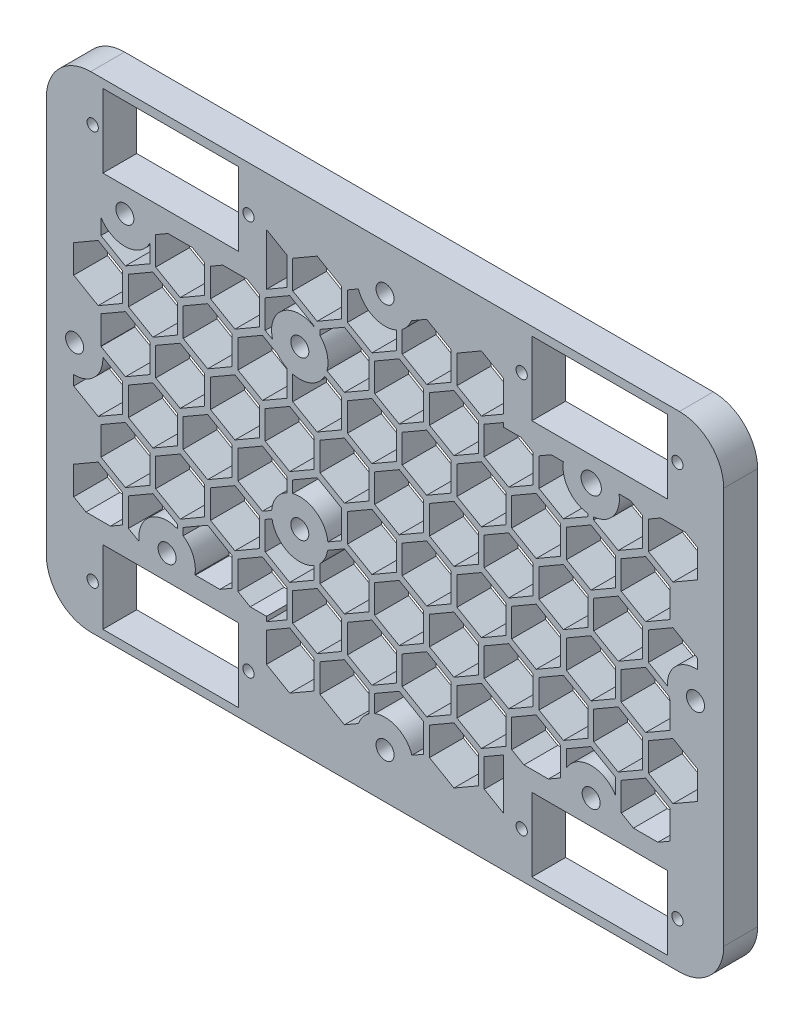
from build123d import *

# Parameters (mm, degrees)
ESQUISSE1_R        = 1.6
PLAQUE_DEPTH       = 6
ESQUISSE3_R        = 1
ESQUISSE3_W        = 24
ESQUISSE3_H        = 13
MIP_SERVO_DEPTH    = 75.060785845
CUT_EXTRUDE1_DEPTH = 10
SKETCH2_R          = 1.8
SKETCH2_R_2        = 1.6
CUT_EXTRUDE2_DEPTH = 10


with BuildPart() as part:
    # Esquisse1 → plaque (new body)
    with BuildSketch(Plane.XY):
        with BuildLine():
            Line((-60, 35.14495853), (-60, -35.14495853))
            ThreePointArc((-60, -35.14495853), (-57.69931162, -40.69931162), (-52.14495853, -43))
            Line((-52.14495853, -43), (52.14495853, -43))
            ThreePointArc((52.14495853, -43), (57.69931162, -40.69931162), (60, -35.14495853))
            Line((60, -35.14495853), (60, 35.14495853))
            ThreePointArc((60, 35.14495853), (57.69931162, 40.69931162), (52.14495853, 43))
            Line((52.14495853, 43), (-52.14495853, 43))
            ThreePointArc((-52.14495853, 43), (-57.69931162, 40.69931162), (-60, 35.14495853))
        make_face()
        with Locations((0, -35)):
            Circle(ESQUISSE1_R, mode=Mode.SUBTRACT)
        with Locations((-55, 0)):
            Circle(ESQUISSE1_R, mode=Mode.SUBTRACT)
        with Locations((55, 0)):
            Circle(ESQUISSE1_R, mode=Mode.SUBTRACT)
        with Locations((0, 35)):
            Circle(ESQUISSE1_R, mode=Mode.SUBTRACT)
    extrude(amount=PLAQUE_DEPTH)

    # Esquisse3 → MIP_SERVO (cut, through all)
    with BuildSketch(Plane.XY):
        with Locations((-51.8, 35)):
            Circle(ESQUISSE3_R)
        with Locations((-24.2, 35)):
            Circle(ESQUISSE3_R)
        with Locations((51.8, 35)):
            Circle(ESQUISSE3_R)
        with Locations((24.2, 35)):
            Circle(ESQUISSE3_R)
        with Locations((24.2, -35)):
            Circle(ESQUISSE3_R)
        with Locations((51.8, -35)):
            Circle(ESQUISSE3_R)
        with Locations((-24.2, -35)):
            Circle(ESQUISSE3_R)
        with Locations((-51.8, -35)):
            Circle(ESQUISSE3_R)
        with Locations((38, 35)):
            Rectangle(ESQUISSE3_W, ESQUISSE3_H)
        with Locations((-38, 35)):
            Rectangle(ESQUISSE3_W, ESQUISSE3_H)
        with Locations((38, -35)):
            Rectangle(ESQUISSE3_W, ESQUISSE3_H)
        with Locations((-38, -35)):
            Rectangle(ESQUISSE3_W, ESQUISSE3_H)
    extrude(amount=MIP_SERVO_DEPTH, mode=Mode.SUBTRACT)

    # Sketch1 → Cut-Extrude1 (cut)
    with BuildSketch(Plane(origin=(0, 0, 0), x_dir=(-1, 0, 0), z_dir=(0, 0, -1))):
        Polygon((-53.165063509, 25), (-55.330127019, 23.75), (-55.330127019, 18.75), (-51, 16.25), (-46.669872981, 18.75), (-46.669872981, 23.75), (-48.834936491, 25), align=None)
        Polygon((-21, 32.480940108), (-21, 27.019059892), (-17.069872981, 24.75), (-12.739745962, 27.25), (-12.739745962, 32.25), (-17.069872981, 34.75), align=None)
        with BuildLine():
            Line((-41.451478548, 25), (-43.465063509, 25))
            Line((-43.465063509, 25), (-45.630127019, 23.75))
            Line((-45.630127019, 23.75), (-45.630127019, 18.75))
            Line((-45.630127019, 18.75), (-41.3, 16.25))
            Line((-41.3, 16.25), (-36.969872981, 18.75))
            Line((-36.969872981, 18.75), (-36.969872981, 19.22418213))
            ThreePointArc((-36.969872981, 19.22418213), (-40.465634941, 21.138335979), (-41.451478548, 25))
        make_face()
        Polygon((-17.569872981, 23.75), (-21, 25.730384758), (-21, 25), (-24.065063509, 25), (-26.230127019, 23.75), (-26.230127019, 18.75), (-21.9, 16.25), (-17.569872981, 18.75), align=None)
        with BuildLine():
            ThreePointArc((-31.579183299, 25), (-32.525099806, 21.190497232), (-35.930127019, 19.23784287))
            Line((-35.930127019, 19.23784287), (-35.930127019, 18.75))
            Line((-35.930127019, 18.75), (-31.6, 16.25))
            Line((-31.6, 16.25), (-27.269872981, 18.75))
            Line((-27.269872981, 18.75), (-27.269872981, 23.75))
            Line((-27.269872981, 23.75), (-29.434936491, 25))
            Line((-29.434936491, 25), (-31.579183299, 25))
        make_face()
        Polygon((-12.2, 26.25), (-16.530127019, 23.75), (-16.530127019, 18.75), (-12.2, 16.25), (-7.869872981, 18.75), (-7.869872981, 23.75), align=None)
        with BuildLine():
            Line((-11.7, 32.25), (-11.7, 27.25))
            Line((-11.7, 27.25), (-7.369872981, 24.75))
            Line((-7.369872981, 24.75), (-3.039745962, 27.25))
            Line((-3.039745962, 27.25), (-3.039745962, 31.030120344))
            ThreePointArc((-3.039745962, 31.030120344), (-3.997227272, 31.996306584), (-4.658867985, 33.184800536))
            Line((-4.658867985, 33.184800536), (-7.369872981, 34.75))
            Line((-7.369872981, 34.75), (-11.7, 32.25))
        make_face()
        with BuildLine():
            ThreePointArc((4.725770022, 33.366874867), (2.008051346, 30.420946627), (-2, 30.417424305))
            Line((-2, 30.417424305), (-2, 27.25))
            Line((-2, 27.25), (2.330127019, 24.75))
            Line((2.330127019, 24.75), (6.660254038, 27.25))
            Line((6.660254038, 27.25), (6.660254038, 32.25))
            Line((6.660254038, 32.25), (4.725770022, 33.366874867))
        make_face()
        Polygon((7.7, 32.25), (7.7, 27.25), (12.030127019, 24.75), (16.360254038, 27.25), (16.360254038, 32.25), (12.030127019, 34.75), align=None)
        Polygon((17.4, 32.25), (17.4, 27.25), (21, 25.171539031), (21, 34.328460969), align=None)
        Polygon((28.765063509, 25), (24.434936491, 25), (22.269872981, 23.75), (22.269872981, 18.75), (26.6, 16.25), (30.930127019, 18.75), (30.930127019, 23.75), align=None)
        with BuildLine():
            Line((50.330127019, 18.75), (50.330127019, 21.52059519))
            ThreePointArc((50.330127019, 21.52059519), (45.888468607, 19.208427064), (41.669872981, 21.906185733))
            Line((41.669872981, 21.906185733), (41.669872981, 18.75))
            Line((41.669872981, 18.75), (46, 16.25))
            Line((46, 16.25), (50.330127019, 18.75))
        make_face()
        Polygon((38.465063509, 25), (34.134936491, 25), (31.969872981, 23.75), (31.969872981, 18.75), (36.3, 16.25), (40.630127019, 18.75), (40.630127019, 23.75), align=None)
        Polygon((-2.5, 26.25), (-6.830127019, 23.75), (-6.830127019, 18.75), (-2.5, 16.25), (1.830127019, 18.75), (1.830127019, 23.75), align=None)
        with BuildLine():
            Line((7.2, 26.25), (2.869872981, 23.75))
            Line((2.869872981, 23.75), (2.869872981, 18.75))
            Line((2.869872981, 18.75), (7.2, 16.25))
            Line((7.2, 16.25), (10.281083306, 18.028864276))
            ThreePointArc((10.281083306, 18.028864276), (10.272174258, 20.587446003), (11.530127019, 22.815443912))
            Line((11.530127019, 22.815443912), (11.530127019, 23.75))
            Line((11.530127019, 23.75), (7.2, 26.25))
        make_face()
        with BuildLine():
            ThreePointArc((16.360254038, 14.483778406), (13.094869832, 14.749117542), (10.694705093, 16.978993791))
            Line((10.694705093, 16.978993791), (7.7, 15.25))
            Line((7.7, 15.25), (7.7, 10.25))
            Line((7.7, 10.25), (12.030127019, 7.75))
            Line((12.030127019, 7.75), (16.360254038, 10.25))
            Line((16.360254038, 10.25), (16.360254038, 14.483778406))
        make_face()
        with BuildLine():
            Line((12.569872981, 23.75), (12.569872981, 23.631596355))
            ThreePointArc((12.569872981, 23.631596355), (18.148070065, 23.296277329), (19.931476585, 18.000223823))
            Line((19.931476585, 18.000223823), (21.230127019, 18.75))
            Line((21.230127019, 18.75), (21.230127019, 23.75))
            Line((21.230127019, 23.75), (16.9, 26.25))
            Line((16.9, 26.25), (12.569872981, 23.75))
        make_face()
        with BuildLine():
            ThreePointArc((18.985197283, 16.165214078), (18.258855695, 15.440944898), (17.4, 14.880137584))
            Line((17.4, 14.880137584), (17.4, 10.25))
            Line((17.4, 10.25), (21.730127019, 7.75))
            Line((21.730127019, 7.75), (26.060254038, 10.25))
            Line((26.060254038, 10.25), (26.060254038, 15.25))
            Line((26.060254038, 15.25), (21.730127019, 17.75))
            Line((21.730127019, 17.75), (18.985197283, 16.165214078))
        make_face()
        Polygon((-41.3, 9.25), (-45.630127019, 6.75), (-45.630127019, 1.75), (-41.3, -0.75), (-36.969872981, 1.75), (-36.969872981, 6.75), align=None)
        Polygon((-36.469872981, 17.75), (-40.8, 15.25), (-40.8, 10.25), (-36.469872981, 7.75), (-32.139745962, 10.25), (-32.139745962, 15.25), align=None)
        Polygon((-31.6, 9.25), (-35.930127019, 6.75), (-35.930127019, 1.75), (-31.6, -0.75), (-27.269872981, 1.75), (-27.269872981, 6.75), align=None)
        Polygon((-26.769872981, 17.75), (-31.1, 15.25), (-31.1, 10.25), (-26.769872981, 7.75), (-22.439745962, 10.25), (-22.439745962, 15.25), align=None)
        Polygon((-21.9, 9.25), (-26.230127019, 6.75), (-26.230127019, 1.75), (-21.9, -0.75), (-17.569872981, 1.75), (-17.569872981, 6.75), align=None)
        Polygon((-17.069872981, 17.75), (-21.4, 15.25), (-21.4, 10.25), (-17.069872981, 7.75), (-12.739745962, 10.25), (-12.739745962, 15.25), align=None)
        Polygon((-12.2, 9.25), (-16.530127019, 6.75), (-16.530127019, 1.75), (-12.2, -0.75), (-7.869872981, 1.75), (-7.869872981, 6.75), align=None)
        Polygon((-7.369872981, 17.75), (-11.7, 15.25), (-11.7, 10.25), (-7.369872981, 7.75), (-3.039745962, 10.25), (-3.039745962, 15.25), align=None)
        Polygon((-2.5, 9.25), (-6.830127019, 6.75), (-6.830127019, 1.75), (-2.5, -0.75), (1.830127019, 1.75), (1.830127019, 6.75), align=None)
        Polygon((2.330127019, 17.75), (-2, 15.25), (-2, 10.25), (2.330127019, 7.75), (6.660254038, 10.25), (6.660254038, 15.25), align=None)
        Polygon((7.2, 9.25), (2.869872981, 6.75), (2.869872981, 1.75), (7.2, -0.75), (11.530127019, 1.75), (11.530127019, 6.75), align=None)
        Polygon((16.9, 9.25), (12.569872981, 6.75), (12.569872981, 1.75), (16.9, -0.75), (21.230127019, 1.75), (21.230127019, 6.75), align=None)
        Polygon((26.6, 9.25), (22.269872981, 6.75), (22.269872981, 1.75), (26.6, -0.75), (30.930127019, 1.75), (30.930127019, 6.75), align=None)
        Polygon((31.430127019, 17.75), (27.1, 15.25), (27.1, 10.25), (31.430127019, 7.75), (35.760254038, 10.25), (35.760254038, 15.25), align=None)
        Polygon((36.3, 9.25), (31.969872981, 6.75), (31.969872981, 1.75), (36.3, -0.75), (40.630127019, 1.75), (40.630127019, 6.75), align=None)
        Polygon((41.130127019, 17.75), (36.8, 15.25), (36.8, 10.25), (41.130127019, 7.75), (45.460254038, 10.25), (45.460254038, 15.25), align=None)
        with BuildLine():
            Line((46, 9.25), (41.669872981, 6.75))
            Line((41.669872981, 6.75), (41.669872981, 1.75))
            Line((41.669872981, 1.75), (46, -0.75))
            Line((46, -0.75), (50.312451188, 1.739794854))
            ThreePointArc((50.312451188, 1.739794854), (50.321230332, 1.7632681), (50.330127019, 1.786697048))
            Line((50.330127019, 1.786697048), (50.330127019, 6.75))
            Line((50.330127019, 6.75), (46, 9.25))
        make_face()
        with BuildLine():
            ThreePointArc((55.160254038, -4.997431204), (51.424057479, -3.494658078), (50.00757366, 0.275098597))
            Line((50.00757366, 0.275098597), (46.5, -1.75))
            Line((46.5, -1.75), (46.5, -6.75))
            Line((46.5, -6.75), (50.830127019, -9.25))
            Line((50.830127019, -9.25), (55.160254038, -6.75))
            Line((55.160254038, -6.75), (55.160254038, -4.997431204))
        make_face()
        Polygon((50.830127019, 17.75), (46.5, 15.25), (46.5, 10.25), (50.830127019, 7.75), (55.160254038, 10.25), (55.160254038, 15.25), align=None)
        Polygon((-41.3, -7.75), (-45.630127019, -10.25), (-45.630127019, -15.25), (-41.3, -17.75), (-36.969872981, -15.25), (-36.969872981, -10.25), align=None)
        Polygon((-36.469872981, 0.75), (-40.8, -1.75), (-40.8, -6.75), (-36.469872981, -9.25), (-32.139745962, -6.75), (-32.139745962, -1.75), align=None)
        Polygon((-31.6, -7.75), (-35.930127019, -10.25), (-35.930127019, -15.25), (-31.6, -17.75), (-27.269872981, -15.25), (-27.269872981, -10.25), align=None)
        Polygon((-26.769872981, 0.75), (-31.1, -1.75), (-31.1, -6.75), (-26.769872981, -9.25), (-22.439745962, -6.75), (-22.439745962, -1.75), align=None)
        Polygon((-21.9, -7.75), (-26.230127019, -10.25), (-26.230127019, -15.25), (-21.9, -17.75), (-17.569872981, -15.25), (-17.569872981, -10.25), align=None)
        Polygon((-17.069872981, 0.75), (-21.4, -1.75), (-21.4, -6.75), (-17.069872981, -9.25), (-12.739745962, -6.75), (-12.739745962, -1.75), align=None)
        Polygon((-12.2, -7.75), (-16.530127019, -10.25), (-16.530127019, -15.25), (-12.2, -17.75), (-7.869872981, -15.25), (-7.869872981, -10.25), align=None)
        Polygon((-7.369872981, 0.75), (-11.7, -1.75), (-11.7, -6.75), (-7.369872981, -9.25), (-3.039745962, -6.75), (-3.039745962, -1.75), align=None)
        Polygon((-2.5, -7.75), (-6.830127019, -10.25), (-6.830127019, -15.25), (-2.5, -17.75), (1.830127019, -15.25), (1.830127019, -10.25), align=None)
        Polygon((2.330127019, 0.75), (-2, -1.75), (-2, -6.75), (2.330127019, -9.25), (6.660254038, -6.75), (6.660254038, -1.75), align=None)
        with BuildLine():
            Line((7.2, -7.75), (2.869872981, -10.25))
            Line((2.869872981, -10.25), (2.869872981, -15.25))
            Line((2.869872981, -15.25), (7.2, -17.75))
            Line((7.2, -17.75), (11.530127019, -15.25))
            Line((11.530127019, -15.25), (11.530127019, -12.181672609))
            ThreePointArc((11.530127019, -12.181672609), (10.638936132, -10.929087436), (10.170400309, -9.464961418))
            Line((10.170400309, -9.464961418), (7.2, -7.75))
        make_face()
        with BuildLine():
            Line((7.7, -6.75), (10.138684778, -8.157975313))
            ThreePointArc((10.138684778, -8.157975313), (12.263794052, -4.5804785), (16.360254038, -3.850007104))
            Line((16.360254038, -3.850007104), (16.360254038, -1.75))
            Line((16.360254038, -1.75), (12.030127019, 0.75))
            Line((12.030127019, 0.75), (7.7, -1.75))
            Line((7.7, -1.75), (7.7, -6.75))
        make_face()
        with BuildLine():
            ThreePointArc((20.034194957, -9.559528302), (17.202061296, -13.232578344), (12.569872981, -12.997825052))
            Line((12.569872981, -12.997825052), (12.569872981, -15.25))
            Line((12.569872981, -15.25), (16.9, -17.75))
            Line((16.9, -17.75), (21.230127019, -15.25))
            Line((21.230127019, -15.25), (21.230127019, -10.25))
            Line((21.230127019, -10.25), (20.034194957, -9.559528302))
        make_face()
        with BuildLine():
            Line((17.4, -1.75), (17.4, -4.246366281))
            ThreePointArc((17.4, -4.246366281), (19.275716321, -5.925673506), (20.095319043, -8.306143175))
            Line((20.095319043, -8.306143175), (21.730127019, -9.25))
            Line((21.730127019, -9.25), (26.060254038, -6.75))
            Line((26.060254038, -6.75), (26.060254038, -1.75))
            Line((26.060254038, -1.75), (21.730127019, 0.75))
            Line((21.730127019, 0.75), (17.4, -1.75))
        make_face()
        Polygon((26.6, -7.75), (22.269872981, -10.25), (22.269872981, -15.25), (26.6, -17.75), (30.930127019, -15.25), (30.930127019, -10.25), align=None)
        Polygon((31.430127019, 0.75), (27.1, -1.75), (27.1, -6.75), (31.430127019, -9.25), (35.760254038, -6.75), (35.760254038, -1.75), align=None)
        Polygon((-7.869872981, -32.25), (-7.869872981, -27.25), (-12.2, -24.75), (-16.530127019, -27.25), (-16.530127019, -32.25), (-12.2, -34.75), align=None)
        with BuildLine():
            Line((-6.830127019, -32.25), (-4.753363182, -33.44902016))
            ThreePointArc((-4.753363182, -33.44902016), (-2.131196229, -30.476947642), (1.830127019, -30.346975704))
            Line((1.830127019, -30.346975704), (1.830127019, -27.25))
            Line((1.830127019, -27.25), (-2.5, -24.75))
            Line((-2.5, -24.75), (-6.830127019, -27.25))
            Line((-6.830127019, -27.25), (-6.830127019, -32.25))
        make_face()
        Polygon((-17.569872981, -32.25), (-17.569872981, -27.25), (-21, -25.269615242), (-21, -34.230384758), align=None)
        with BuildLine():
            Line((2.869872981, -27.25), (2.869872981, -30.905634473))
            ThreePointArc((2.869872981, -30.905634473), (3.9739739, -31.965608555), (4.705700128, -33.309915298))
            Line((4.705700128, -33.309915298), (7.2, -34.75))
            Line((7.2, -34.75), (11.530127019, -32.25))
            Line((11.530127019, -32.25), (11.530127019, -27.25))
            Line((11.530127019, -27.25), (7.2, -24.75))
            Line((7.2, -24.75), (2.869872981, -27.25))
        make_face()
        Polygon((-28.934936491, -25), (-24.604809472, -25), (-22.439745962, -23.75), (-22.439745962, -18.75), (-26.769872981, -16.25), (-31.1, -18.75), (-31.1, -23.75), align=None)
        Polygon((-50.5, -23.75), (-48.334936491, -25), (-44.004809472, -25), (-41.839745962, -23.75), (-41.839745962, -18.75), (-46.169872981, -16.25), (-50.5, -18.75), align=None)
        with BuildLine():
            ThreePointArc((-40.8, -21.555589279), (-36.424369856, -19.133549042), (-32.139745962, -21.713164547))
            Line((-32.139745962, -21.713164547), (-32.139745962, -18.75))
            Line((-32.139745962, -18.75), (-36.469872981, -16.25))
            Line((-36.469872981, -16.25), (-40.8, -18.75))
            Line((-40.8, -18.75), (-40.8, -21.555589279))
        make_face()
        Polygon((36.3, -7.75), (31.969872981, -10.25), (31.969872981, -15.25), (36.3, -17.75), (40.630127019, -15.25), (40.630127019, -10.25), align=None)
        Polygon((41.130127019, 0.75), (36.8, -1.75), (36.8, -6.75), (41.130127019, -9.25), (45.460254038, -6.75), (45.460254038, -1.75), align=None)
        Polygon((46, -7.75), (41.669872981, -10.25), (41.669872981, -15.25), (46, -17.75), (50.330127019, -15.25), (50.330127019, -10.25), align=None)
        Polygon((-17.069872981, -16.25), (-21.4, -18.75), (-21.4, -23.75), (-17.069872981, -26.25), (-12.739745962, -23.75), (-12.739745962, -18.75), align=None)
        Polygon((-7.369872981, -16.25), (-11.7, -18.75), (-11.7, -23.75), (-7.369872981, -26.25), (-3.039745962, -23.75), (-3.039745962, -18.75), align=None)
        Polygon((2.330127019, -16.25), (-2, -18.75), (-2, -23.75), (2.330127019, -26.25), (6.660254038, -23.75), (6.660254038, -18.75), align=None)
        Polygon((12.030127019, -16.25), (7.7, -18.75), (7.7, -23.75), (12.030127019, -26.25), (16.360254038, -23.75), (16.360254038, -18.75), align=None)
        Polygon((16.9, -24.75), (12.569872981, -27.25), (12.569872981, -32.25), (16.9, -34.75), (21, -32.382863896), (21, -27.117136104), align=None)
        Polygon((17.4, -23.75), (21, -25.828460969), (21, -25), (23.895190528, -25), (26.060254038, -23.75), (26.060254038, -18.75), (21.730127019, -16.25), (17.4, -18.75), align=None)
        Polygon((48.665063509, -25), (52.995190528, -25), (55.160254038, -23.75), (55.160254038, -18.75), (50.830127019, -16.25), (46.5, -18.75), (46.5, -23.75), align=None)
        with BuildLine():
            Line((27.1, -23.75), (29.265063509, -25))
            Line((29.265063509, -25), (33.595190528, -25))
            Line((33.595190528, -25), (33.684825894, -24.948248997))
            ThreePointArc((33.684825894, -24.948248997), (34.011200516, -22.188858219), (35.760254038, -20.029791374))
            Line((35.760254038, -20.029791374), (35.760254038, -18.75))
            Line((35.760254038, -18.75), (31.430127019, -16.25))
            Line((31.430127019, -16.25), (27.1, -18.75))
            Line((27.1, -18.75), (27.1, -23.75))
        make_face()
        with BuildLine():
            ThreePointArc((36.8, -19.474894619), (41.725204194, -20.215519971), (43.567166022, -24.842974875))
            Line((43.567166022, -24.842974875), (45.460254038, -23.75))
            Line((45.460254038, -23.75), (45.460254038, -18.75))
            Line((45.460254038, -18.75), (41.130127019, -16.25))
            Line((41.130127019, -16.25), (36.8, -18.75))
            Line((36.8, -18.75), (36.8, -19.474894619))
        make_face()
        with BuildLine():
            Line((-51, 9.25), (-55.330127019, 6.75))
            Line((-55.330127019, 6.75), (-55.330127019, 4.989089712))
            ThreePointArc((-55.330127019, 4.989089712), (-51.520021646, 3.590229889), (-50.003042686, -0.174406426))
            Line((-50.003042686, -0.174406426), (-46.669872981, 1.75))
            Line((-46.669872981, 1.75), (-46.669872981, 6.75))
            Line((-46.669872981, 6.75), (-51, 9.25))
        make_face()
        with BuildLine():
            ThreePointArc((-50.268455017, -1.616317442), (-50.3756476, -1.901411288), (-50.5, -2.179449472))
            Line((-50.5, -2.179449472), (-50.5, -6.75))
            Line((-50.5, -6.75), (-46.169872981, -9.25))
            Line((-46.169872981, -9.25), (-41.839745962, -6.75))
            Line((-41.839745962, -6.75), (-41.839745962, -1.75))
            Line((-41.839745962, -1.75), (-46.169872981, 0.75))
            Line((-46.169872981, 0.75), (-50.268455017, -1.616317442))
        make_face()
        Polygon((-46.169872981, 17.75), (-50.5, 15.25), (-50.5, 10.25), (-46.169872981, 7.75), (-41.839745962, 10.25), (-41.839745962, 15.25), align=None)
        Polygon((-51, -7.75), (-55.330127019, -10.25), (-55.330127019, -15.25), (-51, -17.75), (-46.669872981, -15.25), (-46.669872981, -10.25), align=None)
    extrude(amount=-CUT_EXTRUDE1_DEPTH, mode=Mode.SUBTRACT)

    # Sketch2 → Cut-Extrude2 (cut)
    with BuildSketch(Plane.XY.offset(6)):
        with Locations((36.515330924, 24.203478418)):
            Circle(SKETCH2_R)
        with Locations((36.515330924, -24.132721582)):
            Circle(SKETCH2_R_2)
        with Locations((-15.110169076, 19.324985651)):
            Circle(SKETCH2_R_2)
        with Locations((-15.110169076, -8.691214349)):
            Circle(SKETCH2_R_2)
        with Locations((-38.617869076, -24.132721582)):
            Circle(SKETCH2_R_2)
        with Locations((-46.110869076, 24.203478418)):
            Circle(SKETCH2_R_2)
    extrude(amount=-CUT_EXTRUDE2_DEPTH, mode=Mode.SUBTRACT)


solid = part.part
